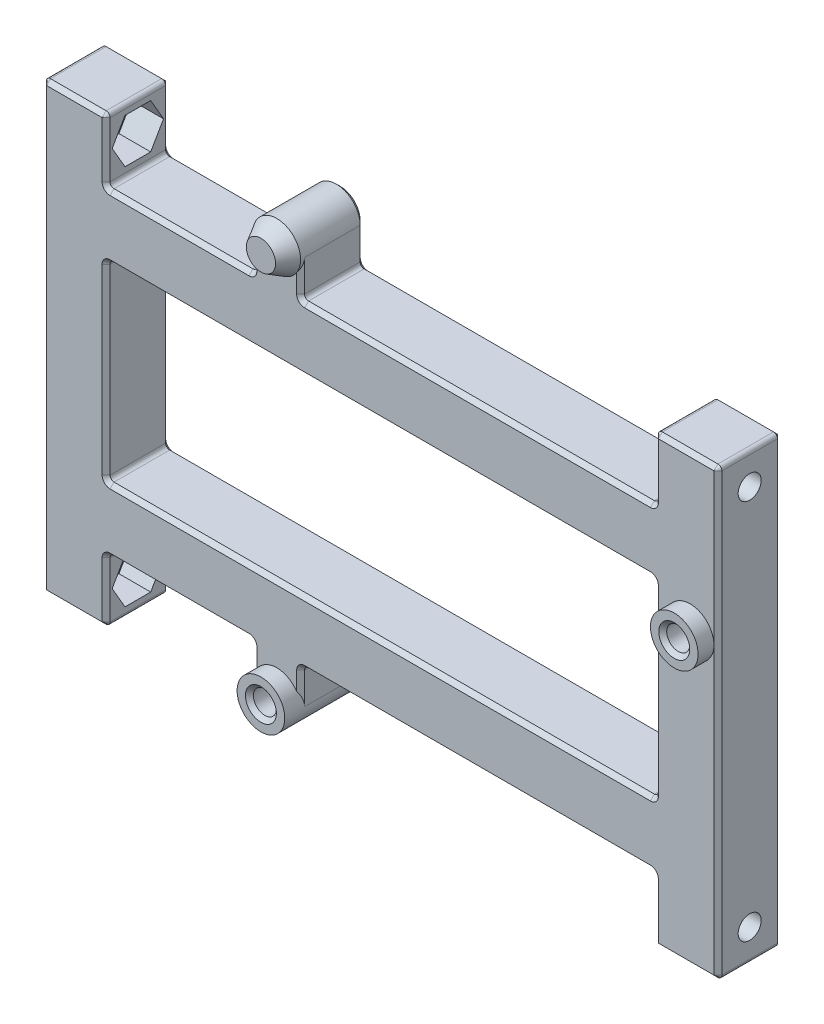
from build123d import *

# Parameters (mm, degrees)
SZKIC1_R                                   = 3
SZKIC1_R_2                                 = 1.45
DODANIE_WYCI_GNI_CIE1_DEPTH                = 10
DODANIE_WYCI_GNI_CIE1_2_DEPTH              = 10
SZKIC2_R                                   = 1.45
SZKIC2_R_2                                 = 3
DODANIE_WYCI_GNI_CIE2_DEPTH                = 8
SZKIC3_R                                   = 3
DODANIE_WYCI_GNI_CIE3_DEPTH                = 2
DODANIE_WYCI_GNI_CIE3_TAPER                = 30
WYTNIJ_WYCI_GNI_CIE1_REACH                 = 103.804
SZKIC4_R                                   = 1.45
WYTNIJ_WYCI_GNI_CIE2_DEPTH                 = 4
LUSTRO1_AT_THE_SECOND_PLANE_COPY_1_REACH   = 103.804
LUSTRO1_AT_THE_SECOND_PLANE_COPY_1_SKETC_R = 1.45
LUSTRO1_AT_THE_SECOND_PLANE_COPY_2_DEPTH   = 4
ZAOKR_GLENIE1_R                            = 0.5
SFAZOWANIE1_SIZE                           = 0.5


with BuildPart() as part:
    # Szkic1 → Dodanie-wyciągnięcie1 (new body)
    with BuildSketch(Plane.XY):
        with Locations((14, 2.55)):
            Circle(SZKIC1_R)
        with Locations((14, 2.55)):
            Circle(SZKIC1_R_2, mode=Mode.SUBTRACT)
    extrude(amount=DODANIE_WYCI_GNI_CIE1_DEPTH)



with BuildPart() as body_2:
    # Szkic1 → Dodanie-wyci_gni_cie1 2 (new body)
    with BuildSketch(Plane.XY):
        with Locations((66.05, 35.55)):
            Circle(SZKIC1_R)
        with Locations((66.05, 35.55)):
            Circle(SZKIC1_R_2, mode=Mode.SUBTRACT)
    extrude(amount=DODANIE_WYCI_GNI_CIE1_2_DEPTH)


with BuildPart() as part_1:
    add(part.part)

    add(body_2.part)  # Dodanie-wyciągnięcie2 merges body 2
    # Szkic2 → Dodanie-wyciągnięcie2 (add)
    # profile 1 of 7: a face of its own
    with BuildSketch(Plane.XY):
        Polygon((-7.5, -0.95), (-7.5, 7.05), (-7.5, 15.05), (-7.5, 39.05), (-7.5, 47.05), (-7.5, 55.05), (-15.5, 55.05), (-15.5, -0.95), align=None)
    # profile 2 of 7: a face of its own
    with BuildSketch(Plane.XY):
        Polygon((-7.5, 47.05), (-7.5, 39.05), (61.55, 39.05), (61.55, 47.05), (17, 47.05), (11, 47.05), align=None)
    # profile 3 of 7: a face of its own
    with BuildSketch(Plane.XY):
        Polygon((-7.5, 7.05), (11, 7.05), (17, 7.05), (61.55, 7.05), (61.55, 15.05), (-7.5, 15.05), align=None)
    # profile 4 of 7: a face of its own
    with BuildSketch(Plane.XY):
        with BuildLine():
            Line((11, 7.05), (11, 2.55))
            ThreePointArc((11, 2.55), (14, -0.45), (17, 2.55))
            Line((17, 2.55), (17, 7.05))
            Line((17, 7.05), (11, 7.05))
        make_face()
        with Locations((14, 2.55)):
            Circle(SZKIC2_R, mode=Mode.SUBTRACT)
    # profile 5 of 7: a face of its own
    with BuildSketch(Plane.XY):
        Polygon((61.55, 15.05), (61.55, 7.05), (61.55, -0.95), (69.55, -0.95), (69.55, 55.05), (61.55, 55.05), (61.55, 47.05), (61.55, 39.05), align=None)
        with Locations((66.05, 35.55)):
            Circle(SZKIC2_R_2, mode=Mode.SUBTRACT)
    # profile 6 of 7: a face of its own
    with BuildSketch(Plane.XY):
        with BuildLine():
            Line((11, 51.55), (11, 47.05))
            Line((11, 47.05), (17, 47.05))
            Line((17, 47.05), (17, 51.55))
            ThreePointArc((17, 51.55), (14, 54.55), (11, 51.55))
        make_face()
        with Locations((14, 51.55)):
            Circle(SZKIC2_R, mode=Mode.SUBTRACT)
    # profile 7 of 7: a face of its own
    with BuildSketch(Plane.XY):
        with Locations((14, 51.55)):
            Circle(SZKIC2_R)
    extrude(amount=DODANIE_WYCI_GNI_CIE2_DEPTH)

    # Szkic3 → Dodanie-wyciągnięcie3 (add)
    with BuildSketch(Plane.XY.offset(8)):
        with Locations((14, 51.55)):
            Circle(SZKIC3_R)
    extrude(amount=DODANIE_WYCI_GNI_CIE3_DEPTH, taper=DODANIE_WYCI_GNI_CIE3_TAPER)

    # Szkic4 → Wytnij-wyciągnięcie1 (cut, up to next)
    with BuildSketch(Plane.ZY.offset(15.5), mode=Mode.PRIVATE) as wytnij_wyci_gni_cie1_sk1:
        with Locations(Location((4, 3.05, 0), (0, 0, 270))):
            Circle(SZKIC4_R)
    wytnij_wyci_gni_cie1_tool1 = extrude(wytnij_wyci_gni_cie1_sk1.sketch, amount=-WYTNIJ_WYCI_GNI_CIE1_REACH, mode=Mode.PRIVATE) & part_1.part
    wytnij_wyci_gni_cie1 = wytnij_wyci_gni_cie1_tool1.solids().sort_by_distance((-15.5, 3.05, 4))[0]
    add(wytnij_wyci_gni_cie1, mode=Mode.SUBTRACT)

    # Szkic5 → Wytnij-wyciągnięcie2 (cut)
    with BuildSketch(Plane(origin=(-7.5, 0, 0), x_dir=(0, 0, -1), z_dir=(1, 0, 0))):
        Polygon((-0.766838493, 3.05), (-2.383419246, 5.85), (-5.616580754, 5.85), (-7.233161507, 3.05), (-5.616580754, 0.25), (-2.383419246, 0.25), align=None)
    wytnij_wyci_gni_cie2 = extrude(amount=-WYTNIJ_WYCI_GNI_CIE2_DEPTH, mode=Mode.SUBTRACT)

    # Lustro1: Wytnij-wyciągnięcie1, Wytnij-wyciągnięcie2 across plane
    add(wytnij_wyci_gni_cie1.mirror(Plane.ZY.offset(-27.025)), mode=Mode.SUBTRACT)
    add(wytnij_wyci_gni_cie2.mirror(Plane.ZY.offset(-27.025)), mode=Mode.SUBTRACT)

    # Lustro1 at the second plane: Wytnij-wyciągnięcie1, Wytnij-wyciągnięcie2 across plane
    add(wytnij_wyci_gni_cie1.mirror(Plane(origin=(0, 27.05, 0), x_dir=(0, 0, 1), z_dir=(0, -1, 0))), mode=Mode.SUBTRACT)
    add(wytnij_wyci_gni_cie2.mirror(Plane(origin=(0, 27.05, 0), x_dir=(0, 0, 1), z_dir=(0, -1, 0))), mode=Mode.SUBTRACT)

    # Lustro1 at the second plane copy 1 sketc → Lustro1 at the second plane copy 1 (cut, up to next)
    with BuildSketch(Plane(origin=(69.55, 54.1, 0), x_dir=(0, 0, 1), z_dir=(1, 0, 0)), mode=Mode.PRIVATE) as lustro1_at_the_second_plane_copy_1_sk1:
        with Locations(Location((4, 3.05, 0), (0, 0, 270))):
            Circle(LUSTRO1_AT_THE_SECOND_PLANE_COPY_1_SKETC_R)
    lustro1_at_the_second_plane_copy_1_tool1 = extrude(lustro1_at_the_second_plane_copy_1_sk1.sketch, amount=-LUSTRO1_AT_THE_SECOND_PLANE_COPY_1_REACH, mode=Mode.PRIVATE) & part_1.part
    add(lustro1_at_the_second_plane_copy_1_tool1.solids().sort_by_distance((69.55, 51.05, 4))[0], mode=Mode.SUBTRACT)

    # Lustro1 at the second plane copy 2 sketc → Lustro1 at the second plane copy 2 (cut)
    with BuildSketch(Plane(origin=(61.55, 54.1, 0), x_dir=(0, 0, -1), z_dir=(-1, 0, 0))):
        Polygon((-0.766838493, 3.05), (-2.383419246, 5.85), (-5.616580754, 5.85), (-7.233161507, 3.05), (-5.616580754, 0.25), (-2.383419246, 0.25), align=None)
    extrude(amount=-LUSTRO1_AT_THE_SECOND_PLANE_COPY_2_DEPTH, mode=Mode.SUBTRACT)

    # Zaokrąglenie1
    zaokr_glenie1_edges = [part_1.edges().sort_by_distance(p)[0] for p in [
        (61.55, 39.05, 4),
        (61.55, 15.05, 4),
        (-7.5, 15.05, 4),
        (17, 7.05, 4),
        (61.55, 7.05, 4),
        (61.55, -0.95, 4),
        (69.55, -0.95, 4),
        (69.55, 55.05, 4),
        (61.55, 55.05, 4),
        (61.55, 47.05, 4),
        (17, 47.05, 4),
        (11, 47.05, 4),
        (-7.5, 47.05, 4),
        (-7.5, 55.05, 4),
        (-15.5, 55.05, 4),
        (-15.5, -0.95, 4),
        (-7.5, -0.95, 4),
        (-7.5, 7.05, 4),
        (11, 7.05, 4),
        (-7.5, 39.05, 4),
    ]]
    fillet(zaokr_glenie1_edges, radius=ZAOKR_GLENIE1_R)

    # Sfazowanie1
    # the kernel refuses this chamfer: 0.5 mm, written as the material it takes off along each edge
    with BuildSketch(Plane(origin=(14, 2.55, 0), x_dir=(-1, 0, 0), z_dir=(0, 1, 0))) as sfazowanie1_piece_1:
        Polygon((3 - SFAZOWANIE1_SIZE, 0), (3, SFAZOWANIE1_SIZE), (3, 0), align=None)
    revolve(axis=Axis((14, 2.55, 0), (0, 0, 1)), revolution_arc=180, mode=Mode.SUBTRACT)
    with BuildSketch(Plane(origin=(10.5, 47.05, 0), x_dir=(0, -1, 0), z_dir=(-1, 0, 0)), Plane(origin=(-7, 7.05, 0), x_dir=(0, 1, 0), z_dir=(1, 0, 0))) as sfazowanie1_piece_2:
        Polygon((SFAZOWANIE1_SIZE, 0), (0, SFAZOWANIE1_SIZE), (0, 0), align=None)
    extrude(amount=17.5, mode=Mode.SUBTRACT)
    with BuildSketch(Plane(origin=(-7, 47.05, 8), x_dir=(0, 0, -1), z_dir=(1, 0, 0)), Plane(origin=(10.5, 7.05, 8), x_dir=(0, 0, -1), z_dir=(-1, 0, 0))) as sfazowanie1_piece_3:
        Polygon((SFAZOWANIE1_SIZE, 0), (0, -SFAZOWANIE1_SIZE), (0, 0), align=None)
    extrude(amount=17.5, mode=Mode.SUBTRACT)
    with BuildSketch(Plane(origin=(17, 47.55, 0), x_dir=(-1, 0, 0), z_dir=(0, 1, 0)), Plane(origin=(17, 2.55, 0), x_dir=(-1, 0, 0), z_dir=(0, 1, 0)), Plane(origin=(11, 6.55, 0), x_dir=(1, 0, 0), z_dir=(0, -1, 0)), Plane(origin=(11, 51.55, 0), x_dir=(1, 0, 0), z_dir=(0, -1, 0))) as sfazowanie1_piece_4:
        Polygon((SFAZOWANIE1_SIZE, 0), (0, SFAZOWANIE1_SIZE), (0, 0), align=None)
    extrude(amount=4, mode=Mode.SUBTRACT)
    with BuildSketch(Plane(origin=(17, 47.55, 8), x_dir=(0, 0, -1), z_dir=(0, 1, 0))) as sfazowanie1_piece_5_section:
        Polygon((SFAZOWANIE1_SIZE, 0), (0, SFAZOWANIE1_SIZE), (0, 0), align=None)
    sfazowanie1_piece_5 = extrude(amount=6.18593054, mode=Mode.PRIVATE)
    sfazowanie1_piece_5 = sfazowanie1_piece_5 - Plane(origin=(14, 51.55, 8), x_dir=(1, 0, 0), z_dir=(0, 0, -1)) * Cylinder(3, 15, mode=Mode.PRIVATE)
    add(sfazowanie1_piece_5, mode=Mode.SUBTRACT)
    with BuildSketch(Plane(origin=(61.05, 47.05, 0), x_dir=(0, -1, 0), z_dir=(-1, 0, 0)), Plane(origin=(17.5, 7.05, 0), x_dir=(0, 1, 0), z_dir=(1, 0, 0))) as sfazowanie1_piece_6:
        Polygon((SFAZOWANIE1_SIZE, 0), (0, SFAZOWANIE1_SIZE), (0, 0), align=None)
    extrude(amount=43.55, mode=Mode.SUBTRACT)
    with BuildSketch(Plane(origin=(17.5, 47.05, 8), x_dir=(0, 0, -1), z_dir=(1, 0, 0)), Plane(origin=(61.05, 7.05, 8), x_dir=(0, 0, -1), z_dir=(-1, 0, 0))) as sfazowanie1_piece_7:
        Polygon((SFAZOWANIE1_SIZE, 0), (0, -SFAZOWANIE1_SIZE), (0, 0), align=None)
    extrude(amount=43.55, mode=Mode.SUBTRACT)
    with BuildSketch(Plane(origin=(69.05, 55.05, 0), x_dir=(0, -1, 0), z_dir=(-1, 0, 0)), Plane(origin=(69.05, 55.05, 8), x_dir=(0, 0, -1), z_dir=(-1, 0, 0)), Plane(origin=(-7.5, -0.45, 0), x_dir=(-1, 0, 0), z_dir=(0, 1, 0)), Plane(origin=(-15, -0.95, 0), x_dir=(0, 1, 0), z_dir=(1, 0, 0)), Plane(origin=(-8, 55.05, 0), x_dir=(0, -1, 0), z_dir=(-1, 0, 0)), Plane(origin=(-7.5, 47.55, 0), x_dir=(-1, 0, 0), z_dir=(0, 1, 0)), Plane(origin=(61.55, 54.55, 0), x_dir=(1, 0, 0), z_dir=(0, -1, 0)), Plane(origin=(62.05, -0.95, 0), x_dir=(0, 1, 0), z_dir=(1, 0, 0)), Plane(origin=(61.55, 6.55, 0), x_dir=(1, 0, 0), z_dir=(0, -1, 0)), Plane(origin=(-8, 55.05, 8), x_dir=(0, 0, -1), z_dir=(-1, 0, 0)), Plane(origin=(-15, -0.95, 8), x_dir=(0, 0, -1), z_dir=(1, 0, 0)), Plane(origin=(62.05, -0.95, 8), x_dir=(0, 0, -1), z_dir=(1, 0, 0))) as sfazowanie1_piece_8:
        Polygon((SFAZOWANIE1_SIZE, 0), (0, SFAZOWANIE1_SIZE), (0, 0), align=None)
    extrude(amount=7, mode=Mode.SUBTRACT)
    with BuildSketch(Plane(origin=(-15.5, 54.55, 0), x_dir=(1, 0, 0), z_dir=(0, -1, 0)), Plane(origin=(69.55, -0.45, 0), x_dir=(-1, 0, 0), z_dir=(0, 1, 0)), Plane(origin=(69.55, -0.45, 8), x_dir=(0, 0, -1), z_dir=(0, 1, 0)), Plane(origin=(-15.5, 54.55, 8), x_dir=(0, 0, -1), z_dir=(0, -1, 0))) as sfazowanie1_piece_9:
        Polygon((SFAZOWANIE1_SIZE, 0), (0, SFAZOWANIE1_SIZE), (0, 0), align=None)
    extrude(amount=55, mode=Mode.SUBTRACT)
    with BuildSketch(Plane(origin=(11, 53.73593054, 8), x_dir=(0, 0, -1), z_dir=(0, -1, 0))) as sfazowanie1_piece_10_section:
        Polygon((SFAZOWANIE1_SIZE, 0), (0, SFAZOWANIE1_SIZE), (0, 0), align=None)
    sfazowanie1_piece_10 = extrude(amount=6.18593054, mode=Mode.PRIVATE)
    sfazowanie1_piece_10 = sfazowanie1_piece_10 - Plane(origin=(14, 51.55, 8), x_dir=(1, 0, 0), z_dir=(0, 0, -1)) * Cylinder(3, 15, mode=Mode.PRIVATE)
    add(sfazowanie1_piece_10, mode=Mode.SUBTRACT)
    with BuildSketch(Plane(origin=(61.55, 38.55, 0), x_dir=(1, 0, 0), z_dir=(0, -1, 0)), Plane(origin=(-7.5, 15.55, 0), x_dir=(-1, 0, 0), z_dir=(0, 1, 0))) as sfazowanie1_piece_11:
        Polygon((SFAZOWANIE1_SIZE, 0), (0, SFAZOWANIE1_SIZE), (0, 0), align=None)
    extrude(amount=23, mode=Mode.SUBTRACT)
    with BuildSketch(Plane(origin=(-7, 39.05, 0), x_dir=(0, 1, 0), z_dir=(1, 0, 0)), Plane(origin=(61.05, 15.05, 0), x_dir=(0, -1, 0), z_dir=(-1, 0, 0)), Plane(origin=(61.05, 15.05, 8), x_dir=(0, 0, -1), z_dir=(-1, 0, 0)), Plane(origin=(-7, 39.05, 8), x_dir=(0, 0, -1), z_dir=(1, 0, 0))) as sfazowanie1_piece_12:
        Polygon((SFAZOWANIE1_SIZE, 0), (0, SFAZOWANIE1_SIZE), (0, 0), align=None)
    extrude(amount=68.05, mode=Mode.SUBTRACT)
    with BuildSketch(Plane(origin=(61.55, 15.55, 8), x_dir=(0, 0, -1), z_dir=(0, 1, 0)), Plane(origin=(-7.5, 38.55, 8), x_dir=(0, 0, -1), z_dir=(0, -1, 0))) as sfazowanie1_piece_13:
        Polygon((SFAZOWANIE1_SIZE, 0), (0, -SFAZOWANIE1_SIZE), (0, 0), align=None)
    extrude(amount=23, mode=Mode.SUBTRACT)
    with BuildSketch(Plane(origin=(-7.5, 54.55, 8), x_dir=(0, 0, -1), z_dir=(0, -1, 0)), Plane(origin=(-7.5, 6.55, 8), x_dir=(0, 0, -1), z_dir=(0, -1, 0)), Plane(origin=(61.55, -0.45, 8), x_dir=(0, 0, -1), z_dir=(0, 1, 0)), Plane(origin=(61.55, 47.55, 8), x_dir=(0, 0, -1), z_dir=(0, 1, 0))) as sfazowanie1_piece_14:
        Polygon((SFAZOWANIE1_SIZE, 0), (0, -SFAZOWANIE1_SIZE), (0, 0), align=None)
    extrude(amount=7, mode=Mode.SUBTRACT)
    with BuildSketch(Plane(origin=(17, 0.36406946, 8), x_dir=(0, 0, -1), z_dir=(0, 1, 0))) as sfazowanie1_piece_15_section:
        Polygon((SFAZOWANIE1_SIZE, 0), (0, SFAZOWANIE1_SIZE), (0, 0), align=None)
    sfazowanie1_piece_15 = extrude(amount=6.18593054, mode=Mode.PRIVATE)
    sfazowanie1_piece_15 = sfazowanie1_piece_15 - Plane(origin=(14, 2.55, 8), x_dir=(1, 0, 0), z_dir=(0, 0, -1)) * Cylinder(3, 15, mode=Mode.PRIVATE)
    add(sfazowanie1_piece_15, mode=Mode.SUBTRACT)
    with BuildSketch(Plane(origin=(14, 51.55, 0), x_dir=(1, 0, 0), z_dir=(0, -1, 0))) as sfazowanie1_piece_16:
        Polygon((3 - SFAZOWANIE1_SIZE, 0), (3, SFAZOWANIE1_SIZE), (3, 0), align=None)
    revolve(axis=Axis((14, 51.55, 0), (0, 0, 1)), revolution_arc=180, mode=Mode.SUBTRACT)
    with BuildSketch(Plane(origin=(10.5, 47.55, 0), x_dir=(1, 0, 0), z_dir=(0, 1, 0))) as sfazowanie1_piece_17:
        Polygon((0.5 + SFAZOWANIE1_SIZE, 0), (0.5, -SFAZOWANIE1_SIZE), (0.5, 0), align=None)
    revolve(axis=Axis((10.5, 47.55, 0), (0, 0, -1)), revolution_arc=90, mode=Mode.SUBTRACT)
    with BuildSketch(Plane(origin=(10.5, 47.55, 8), x_dir=(1, 0, 0), z_dir=(0, 1, 0))) as sfazowanie1_piece_18:
        Polygon((0.5, SFAZOWANIE1_SIZE), (0.5 + SFAZOWANIE1_SIZE, 0), (0.5, 0), align=None)
    revolve(axis=Axis((10.5, 47.55, 8), (0, 0, -1)), revolution_arc=90, mode=Mode.SUBTRACT)
    with BuildSketch(Plane(origin=(17.5, 47.55, 0), x_dir=(0, -1, 0), z_dir=(1, 0, 0))) as sfazowanie1_piece_19:
        Polygon((0.5 + SFAZOWANIE1_SIZE, 0), (0.5, -SFAZOWANIE1_SIZE), (0.5, 0), align=None)
    revolve(axis=Axis((17.5, 47.55, 0), (0, 0, -1)), revolution_arc=90, mode=Mode.SUBTRACT)
    with BuildSketch(Plane(origin=(17.5, 47.55, 8), x_dir=(0, -1, 0), z_dir=(1, 0, 0))) as sfazowanie1_piece_20:
        Polygon((0.5, SFAZOWANIE1_SIZE), (0.5 + SFAZOWANIE1_SIZE, 0), (0.5, 0), align=None)
    revolve(axis=Axis((17.5, 47.55, 8), (0, 0, -1)), revolution_arc=90, mode=Mode.SUBTRACT)
    with BuildSketch(Plane(origin=(61.05, 47.55, 0), x_dir=(1, 0, 0), z_dir=(0, 1, 0))) as sfazowanie1_piece_21:
        Polygon((0.5 + SFAZOWANIE1_SIZE, 0), (0.5, -SFAZOWANIE1_SIZE), (0.5, 0), align=None)
    revolve(axis=Axis((61.05, 47.55, 0), (0, 0, -1)), revolution_arc=90, mode=Mode.SUBTRACT)
    with BuildSketch(Plane(origin=(61.05, 47.55, 8), x_dir=(1, 0, 0), z_dir=(0, 1, 0))) as sfazowanie1_piece_22:
        Polygon((0.5, SFAZOWANIE1_SIZE), (0.5 + SFAZOWANIE1_SIZE, 0), (0.5, 0), align=None)
    revolve(axis=Axis((61.05, 47.55, 8), (0, 0, -1)), revolution_arc=90, mode=Mode.SUBTRACT)
    with BuildSketch(Plane(origin=(61.05, 15.55, 0), x_dir=(1, 0, 0), z_dir=(0, 1, 0))) as sfazowanie1_piece_23:
        Polygon((0.5 + SFAZOWANIE1_SIZE, 0), (0.5, -SFAZOWANIE1_SIZE), (0.5, 0), align=None)
    revolve(axis=Axis((61.05, 15.55, 0), (0, 0, -1)), revolution_arc=90, mode=Mode.SUBTRACT)
    with BuildSketch(Plane(origin=(61.05, 15.55, 8), x_dir=(1, 0, 0), z_dir=(0, 1, 0))) as sfazowanie1_piece_24:
        Polygon((0.5, SFAZOWANIE1_SIZE), (0.5 + SFAZOWANIE1_SIZE, 0), (0.5, 0), align=None)
    revolve(axis=Axis((61.05, 15.55, 8), (0, 0, -1)), revolution_arc=90, mode=Mode.SUBTRACT)
    with BuildSketch(Plane(origin=(-7, 15.55, 0), x_dir=(0, -1, 0), z_dir=(1, 0, 0))) as sfazowanie1_piece_25:
        Polygon((0.5 + SFAZOWANIE1_SIZE, 0), (0.5, -SFAZOWANIE1_SIZE), (0.5, 0), align=None)
    revolve(axis=Axis((-7, 15.55, 0), (0, 0, -1)), revolution_arc=90, mode=Mode.SUBTRACT)
    with BuildSketch(Plane(origin=(-7, 15.55, 8), x_dir=(0, -1, 0), z_dir=(1, 0, 0))) as sfazowanie1_piece_26:
        Polygon((0.5, SFAZOWANIE1_SIZE), (0.5 + SFAZOWANIE1_SIZE, 0), (0.5, 0), align=None)
    revolve(axis=Axis((-7, 15.55, 8), (0, 0, -1)), revolution_arc=90, mode=Mode.SUBTRACT)
    with BuildSketch(Plane(origin=(-7, 47.55, 0), x_dir=(0, -1, 0), z_dir=(1, 0, 0))) as sfazowanie1_piece_27:
        Polygon((0.5 + SFAZOWANIE1_SIZE, 0), (0.5, -SFAZOWANIE1_SIZE), (0.5, 0), align=None)
    revolve(axis=Axis((-7, 47.55, 0), (0, 0, -1)), revolution_arc=90, mode=Mode.SUBTRACT)
    with BuildSketch(Plane(origin=(-7, 47.55, 8), x_dir=(0, -1, 0), z_dir=(1, 0, 0))) as sfazowanie1_piece_28:
        Polygon((0.5, SFAZOWANIE1_SIZE), (0.5 + SFAZOWANIE1_SIZE, 0), (0.5, 0), align=None)
    revolve(axis=Axis((-7, 47.55, 8), (0, 0, -1)), revolution_arc=90, mode=Mode.SUBTRACT)
    with BuildSketch(Plane(origin=(-7, 38.55, 0), x_dir=(-1, 0, 0), z_dir=(0, -1, 0))) as sfazowanie1_piece_29:
        Polygon((0.5 + SFAZOWANIE1_SIZE, 0), (0.5, -SFAZOWANIE1_SIZE), (0.5, 0), align=None)
    revolve(axis=Axis((-7, 38.55, 0), (0, 0, -1)), revolution_arc=90, mode=Mode.SUBTRACT)
    with BuildSketch(Plane(origin=(-7, 38.55, 8), x_dir=(-1, 0, 0), z_dir=(0, -1, 0))) as sfazowanie1_piece_30:
        Polygon((0.5, SFAZOWANIE1_SIZE), (0.5 + SFAZOWANIE1_SIZE, 0), (0.5, 0), align=None)
    revolve(axis=Axis((-7, 38.55, 8), (0, 0, -1)), revolution_arc=90, mode=Mode.SUBTRACT)
    with BuildSketch(Plane(origin=(61.05, 38.55, 0), x_dir=(1, 0, 0), z_dir=(0, -1, 0))) as sfazowanie1_piece_31:
        Polygon((0.5 + SFAZOWANIE1_SIZE, 0), (0.5, SFAZOWANIE1_SIZE), (0.5, 0), align=None)
    revolve(axis=Axis((61.05, 38.55, 0), (0, 0, 1)), revolution_arc=90, mode=Mode.SUBTRACT)
    with BuildSketch(Plane(origin=(61.05, 38.55, 8), x_dir=(1, 0, 0), z_dir=(0, -1, 0))) as sfazowanie1_piece_32:
        Polygon((0.5, -SFAZOWANIE1_SIZE), (0.5 + SFAZOWANIE1_SIZE, 0), (0.5, 0), align=None)
    revolve(axis=Axis((61.05, 38.55, 8), (0, 0, 1)), revolution_arc=90, mode=Mode.SUBTRACT)
    with BuildSketch(Plane(origin=(61.05, 6.55, 0), x_dir=(0, 1, 0), z_dir=(-1, 0, 0))) as sfazowanie1_piece_33:
        Polygon((0.5 + SFAZOWANIE1_SIZE, 0), (0.5, -SFAZOWANIE1_SIZE), (0.5, 0), align=None)
    revolve(axis=Axis((61.05, 6.55, 0), (0, 0, -1)), revolution_arc=90, mode=Mode.SUBTRACT)
    with BuildSketch(Plane(origin=(61.05, 6.55, 8), x_dir=(0, 1, 0), z_dir=(-1, 0, 0))) as sfazowanie1_piece_34:
        Polygon((0.5, SFAZOWANIE1_SIZE), (0.5 + SFAZOWANIE1_SIZE, 0), (0.5, 0), align=None)
    revolve(axis=Axis((61.05, 6.55, 8), (0, 0, -1)), revolution_arc=90, mode=Mode.SUBTRACT)
    with BuildSketch(Plane(origin=(17.5, 6.55, 0), x_dir=(-1, 0, 0), z_dir=(0, -1, 0))) as sfazowanie1_piece_35:
        Polygon((0.5 + SFAZOWANIE1_SIZE, 0), (0.5, -SFAZOWANIE1_SIZE), (0.5, 0), align=None)
    revolve(axis=Axis((17.5, 6.55, 0), (0, 0, -1)), revolution_arc=90, mode=Mode.SUBTRACT)
    with BuildSketch(Plane(origin=(17.5, 6.55, 8), x_dir=(-1, 0, 0), z_dir=(0, -1, 0))) as sfazowanie1_piece_36:
        Polygon((0.5, SFAZOWANIE1_SIZE), (0.5 + SFAZOWANIE1_SIZE, 0), (0.5, 0), align=None)
    revolve(axis=Axis((17.5, 6.55, 8), (0, 0, -1)), revolution_arc=90, mode=Mode.SUBTRACT)
    with BuildSketch(Plane(origin=(10.5, 6.55, 0), x_dir=(0, 1, 0), z_dir=(-1, 0, 0))) as sfazowanie1_piece_37:
        Polygon((0.5 + SFAZOWANIE1_SIZE, 0), (0.5, -SFAZOWANIE1_SIZE), (0.5, 0), align=None)
    revolve(axis=Axis((10.5, 6.55, 0), (0, 0, -1)), revolution_arc=90, mode=Mode.SUBTRACT)
    with BuildSketch(Plane(origin=(10.5, 6.55, 8), x_dir=(0, 1, 0), z_dir=(-1, 0, 0))) as sfazowanie1_piece_38:
        Polygon((0.5, SFAZOWANIE1_SIZE), (0.5 + SFAZOWANIE1_SIZE, 0), (0.5, 0), align=None)
    revolve(axis=Axis((10.5, 6.55, 8), (0, 0, -1)), revolution_arc=90, mode=Mode.SUBTRACT)
    with BuildSketch(Plane(origin=(-7, 6.55, 0), x_dir=(-1, 0, 0), z_dir=(0, -1, 0))) as sfazowanie1_piece_39:
        Polygon((0.5 + SFAZOWANIE1_SIZE, 0), (0.5, -SFAZOWANIE1_SIZE), (0.5, 0), align=None)
    revolve(axis=Axis((-7, 6.55, 0), (0, 0, -1)), revolution_arc=90, mode=Mode.SUBTRACT)
    with BuildSketch(Plane(origin=(-7, 6.55, 8), x_dir=(-1, 0, 0), z_dir=(0, -1, 0))) as sfazowanie1_piece_40:
        Polygon((0.5, SFAZOWANIE1_SIZE), (0.5 + SFAZOWANIE1_SIZE, 0), (0.5, 0), align=None)
    revolve(axis=Axis((-7, 6.55, 8), (0, 0, -1)), revolution_arc=90, mode=Mode.SUBTRACT)
    with BuildSketch(Plane(origin=(11, 6.55, 8), x_dir=(0, 0, -1), z_dir=(0, -1, 0))) as sfazowanie1_piece_41_section:
        Polygon((SFAZOWANIE1_SIZE, 0), (0, SFAZOWANIE1_SIZE), (0, 0), align=None)
    sfazowanie1_piece_41 = extrude(amount=6.18593054, mode=Mode.PRIVATE)
    sfazowanie1_piece_41 = sfazowanie1_piece_41 - Plane(origin=(14, 2.55, 8), x_dir=(1, 0, 0), z_dir=(0, 0, -1)) * Cylinder(3, 15, mode=Mode.PRIVATE)
    add(sfazowanie1_piece_41, mode=Mode.SUBTRACT)
    with BuildSketch(Plane(origin=(14, 2.55, 10), x_dir=(1, 0, 0), z_dir=(0, -1, 0))) as sfazowanie1_piece_42:
        Polygon((1.45, -SFAZOWANIE1_SIZE), (1.45 + SFAZOWANIE1_SIZE, 0), (1.45, 0), align=None)
    revolve(axis=Axis((14, 2.55, 10), (0, 0, 1)), mode=Mode.SUBTRACT)
    with BuildSketch(Plane(origin=(66.05, 35.55, 10), x_dir=(1, 0, 0), z_dir=(0, -1, 0))) as sfazowanie1_piece_43:
        Polygon((1.45, -SFAZOWANIE1_SIZE), (1.45 + SFAZOWANIE1_SIZE, 0), (1.45, 0), align=None)
    revolve(axis=Axis((66.05, 35.55, 10), (0, 0, 1)), mode=Mode.SUBTRACT)
    with BuildSketch(Plane(origin=(62.05, 54.55, 8), x_dir=(0, 1, 0), z_dir=(1, 0, 0))) as sfazowanie1_piece_44:
        Polygon((0.5, -SFAZOWANIE1_SIZE), (0.5 - SFAZOWANIE1_SIZE, 0), (0.5, 0), align=None)
    revolve(axis=Axis((62.05, 54.55, 8), (0, 0, 1)), revolution_arc=90, mode=Mode.SUBTRACT)
    with BuildSketch(Plane(origin=(62.05, -0.45, 8), x_dir=(-1, 0, 0), z_dir=(0, 1, 0))) as sfazowanie1_piece_45:
        Polygon((0.5, -SFAZOWANIE1_SIZE), (0.5 - SFAZOWANIE1_SIZE, 0), (0.5, 0), align=None)
    revolve(axis=Axis((62.05, -0.45, 8), (0, 0, 1)), revolution_arc=90, mode=Mode.SUBTRACT)
    with BuildSketch(Plane(origin=(69.05, -0.45, 8), x_dir=(0, -1, 0), z_dir=(-1, 0, 0))) as sfazowanie1_piece_46:
        Polygon((0.5, -SFAZOWANIE1_SIZE), (0.5 - SFAZOWANIE1_SIZE, 0), (0.5, 0), align=None)
    revolve(axis=Axis((69.05, -0.45, 8), (0, 0, 1)), revolution_arc=90, mode=Mode.SUBTRACT)
    with BuildSketch(Plane(origin=(-8, -0.45, 8), x_dir=(0, -1, 0), z_dir=(-1, 0, 0))) as sfazowanie1_piece_47:
        Polygon((0.5, -SFAZOWANIE1_SIZE), (0.5 - SFAZOWANIE1_SIZE, 0), (0.5, 0), align=None)
    revolve(axis=Axis((-8, -0.45, 8), (0, 0, 1)), revolution_arc=90, mode=Mode.SUBTRACT)
    with BuildSketch(Plane(origin=(-15, -0.45, 8), x_dir=(-1, 0, 0), z_dir=(0, 1, 0))) as sfazowanie1_piece_48:
        Polygon((0.5, -SFAZOWANIE1_SIZE), (0.5 - SFAZOWANIE1_SIZE, 0), (0.5, 0), align=None)
    revolve(axis=Axis((-15, -0.45, 8), (0, 0, 1)), revolution_arc=90, mode=Mode.SUBTRACT)
    with BuildSketch(Plane(origin=(-15, 54.55, 8), x_dir=(0, 1, 0), z_dir=(1, 0, 0))) as sfazowanie1_piece_49:
        Polygon((0.5, -SFAZOWANIE1_SIZE), (0.5 - SFAZOWANIE1_SIZE, 0), (0.5, 0), align=None)
    revolve(axis=Axis((-15, 54.55, 8), (0, 0, 1)), revolution_arc=90, mode=Mode.SUBTRACT)
    with BuildSketch(Plane(origin=(-8, 54.55, 8), x_dir=(1, 0, 0), z_dir=(0, -1, 0))) as sfazowanie1_piece_50:
        Polygon((0.5, -SFAZOWANIE1_SIZE), (0.5 - SFAZOWANIE1_SIZE, 0), (0.5, 0), align=None)
    revolve(axis=Axis((-8, 54.55, 8), (0, 0, 1)), revolution_arc=90, mode=Mode.SUBTRACT)
    with BuildSketch(Plane(origin=(69.05, 54.55, 8), x_dir=(1, 0, 0), z_dir=(0, -1, 0))) as sfazowanie1_piece_51:
        Polygon((0.5, -SFAZOWANIE1_SIZE), (0.5 - SFAZOWANIE1_SIZE, 0), (0.5, 0), align=None)
    revolve(axis=Axis((69.05, 54.55, 8), (0, 0, 1)), revolution_arc=90, mode=Mode.SUBTRACT)
    with BuildSketch(Plane(origin=(62.05, -0.45, 0), x_dir=(-1, 0, 0), z_dir=(0, 1, 0))) as sfazowanie1_piece_52:
        Polygon((0.5 - SFAZOWANIE1_SIZE, 0), (0.5, SFAZOWANIE1_SIZE), (0.5, 0), align=None)
    revolve(axis=Axis((62.05, -0.45, 0), (0, 0, 1)), revolution_arc=90, mode=Mode.SUBTRACT)
    with BuildSketch(Plane(origin=(69.05, -0.45, 0), x_dir=(0, -1, 0), z_dir=(-1, 0, 0))) as sfazowanie1_piece_53:
        Polygon((0.5 - SFAZOWANIE1_SIZE, 0), (0.5, SFAZOWANIE1_SIZE), (0.5, 0), align=None)
    revolve(axis=Axis((69.05, -0.45, 0), (0, 0, 1)), revolution_arc=90, mode=Mode.SUBTRACT)
    with BuildSketch(Plane(origin=(69.05, 54.55, 0), x_dir=(1, 0, 0), z_dir=(0, -1, 0))) as sfazowanie1_piece_54:
        Polygon((0.5 - SFAZOWANIE1_SIZE, 0), (0.5, SFAZOWANIE1_SIZE), (0.5, 0), align=None)
    revolve(axis=Axis((69.05, 54.55, 0), (0, 0, 1)), revolution_arc=90, mode=Mode.SUBTRACT)
    with BuildSketch(Plane(origin=(62.05, 54.55, 0), x_dir=(0, 1, 0), z_dir=(1, 0, 0))) as sfazowanie1_piece_55:
        Polygon((0.5 - SFAZOWANIE1_SIZE, 0), (0.5, SFAZOWANIE1_SIZE), (0.5, 0), align=None)
    revolve(axis=Axis((62.05, 54.55, 0), (0, 0, 1)), revolution_arc=90, mode=Mode.SUBTRACT)
    with BuildSketch(Plane(origin=(-8, 54.55, 0), x_dir=(1, 0, 0), z_dir=(0, -1, 0))) as sfazowanie1_piece_56:
        Polygon((0.5 - SFAZOWANIE1_SIZE, 0), (0.5, SFAZOWANIE1_SIZE), (0.5, 0), align=None)
    revolve(axis=Axis((-8, 54.55, 0), (0, 0, 1)), revolution_arc=90, mode=Mode.SUBTRACT)
    with BuildSketch(Plane(origin=(-15, 54.55, 0), x_dir=(0, 1, 0), z_dir=(1, 0, 0))) as sfazowanie1_piece_57:
        Polygon((0.5 - SFAZOWANIE1_SIZE, 0), (0.5, SFAZOWANIE1_SIZE), (0.5, 0), align=None)
    revolve(axis=Axis((-15, 54.55, 0), (0, 0, 1)), revolution_arc=90, mode=Mode.SUBTRACT)
    with BuildSketch(Plane(origin=(-15, -0.45, 0), x_dir=(-1, 0, 0), z_dir=(0, 1, 0))) as sfazowanie1_piece_58:
        Polygon((0.5 - SFAZOWANIE1_SIZE, 0), (0.5, SFAZOWANIE1_SIZE), (0.5, 0), align=None)
    revolve(axis=Axis((-15, -0.45, 0), (0, 0, 1)), revolution_arc=90, mode=Mode.SUBTRACT)
    with BuildSketch(Plane(origin=(-8, -0.45, 0), x_dir=(0, -1, 0), z_dir=(-1, 0, 0))) as sfazowanie1_piece_59:
        Polygon((0.5 - SFAZOWANIE1_SIZE, 0), (0.5, SFAZOWANIE1_SIZE), (0.5, 0), align=None)
    revolve(axis=Axis((-8, -0.45, 0), (0, 0, 1)), revolution_arc=90, mode=Mode.SUBTRACT)


solid = part_1.part
